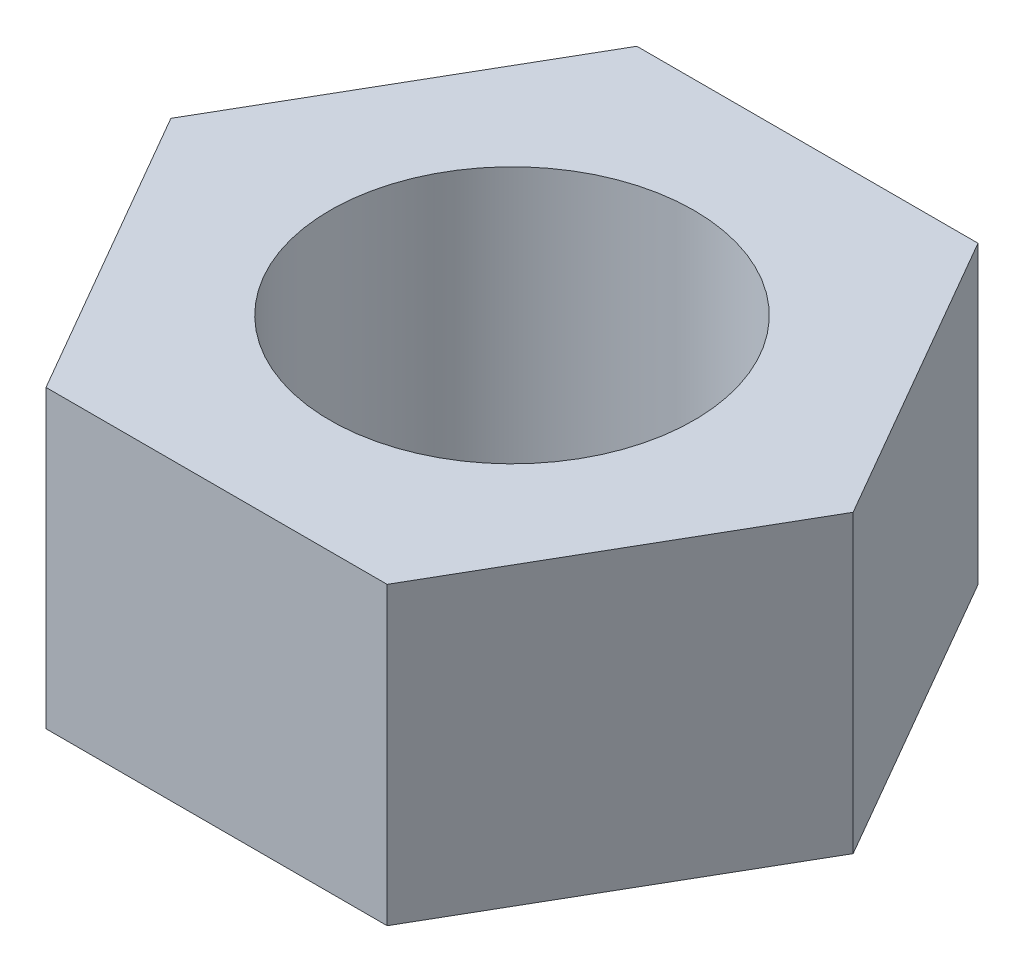
from build123d import *

# Parameters (mm, degrees)
SKETCH1_R           = 4
BOSS_EXTRUDE1_DEPTH = 6.5


with BuildPart() as part:
    # Sketch1 → Boss-Extrude1 (new body)
    with BuildSketch(Plane(origin=(0, 0, 0), x_dir=(1, 0, 0), z_dir=(0, 1, 0))):
        Polygon((3.75, -6.495190528), (7.5, 0), (3.75, 6.495190528), (-3.75, 6.495190528), (-7.5, 0), (-3.75, -6.495190528), align=None)
        Circle(SKETCH1_R, mode=Mode.SUBTRACT)
    extrude(amount=BOSS_EXTRUDE1_DEPTH)


solid = part.part
